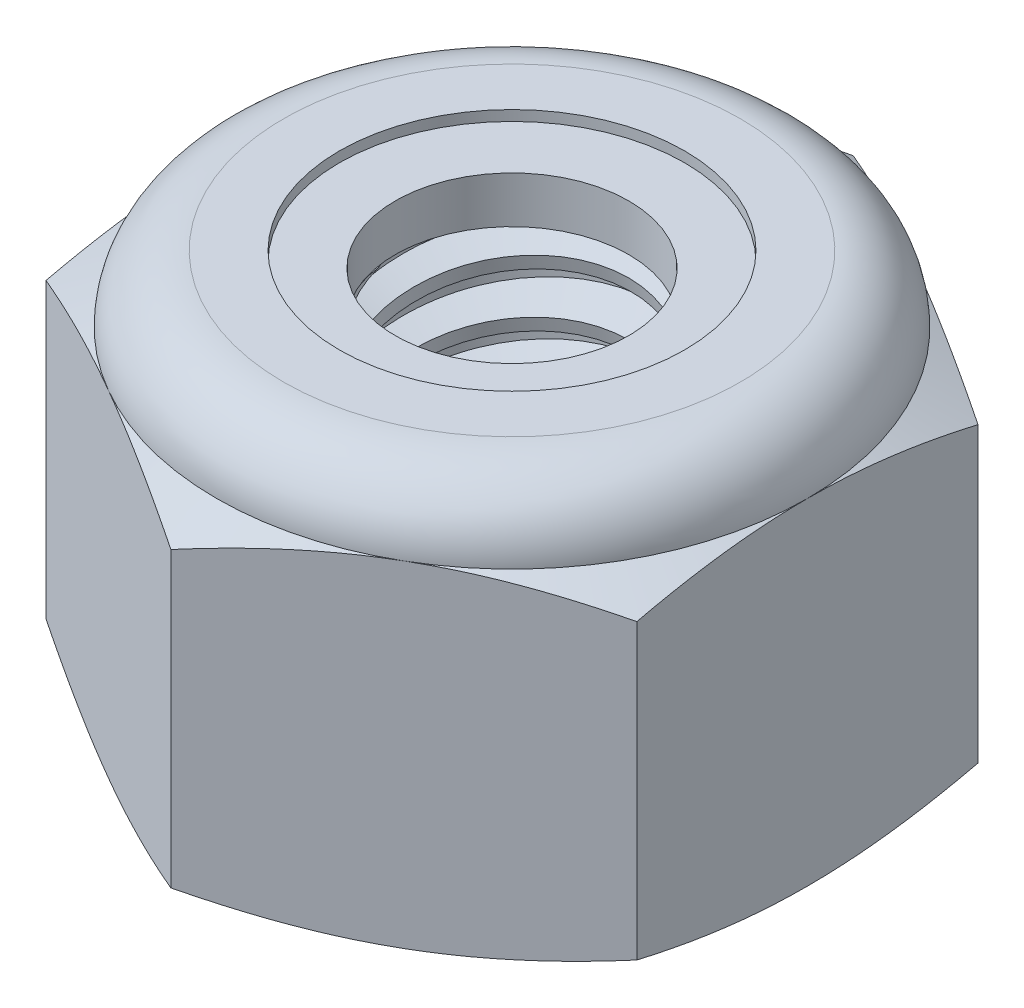
from build123d import *

# Parameters (mm, degrees)
EXTRUDE1_DEPTH       = 5.953125
SKETCH2_W            = 2.0828
SKETCH2_H            = 5.953125
LPATTERN1_COUNT      = 8
LPATTERN1_PITCH      = 0.79375
LPATTERN1_COUNT_DIR2 = 2
LPATTERN1_PITCH_DIR2 = 0.79375


with BuildPart() as part:
    # Sketch1 → Extrude1 (new body)
    with BuildSketch(Plane(origin=(0, 0, 0), x_dir=(1, 0, 0), z_dir=(0, 1, 0))):
        Polygon((0, 5.040989538), (-4.365625, 2.520494769), (-4.365625, -2.520494769), (0, -5.040989538), (4.365625, -2.520494769), (4.365625, 2.520494769), align=None)
    extrude(amount=EXTRUDE1_DEPTH)

    # Sketch4 → Cut-Revolve2 (revolve, cut)
    with BuildSketch(Plane(origin=(0, 0, 0), x_dir=(0, 0, -1), z_dir=(1, 0, 0))):
        Polygon((0, 5.953125), (2.0828, 5.953125), (1.725765218, 5.786636947), (1.725765218, 0.166488053), (2.0828, 0), (0, 0), align=None)
    revolve(axis=Axis((0, 5.953125, 0), (0, 1, 0)), mode=Mode.SUBTRACT)


with BuildPart() as body_2:
    # Sketch2 → Revolve1 (revolve)
    with BuildSketch(Plane(origin=(0, 0, 0), x_dir=(0, 0, -1), z_dir=(1, 0, 0))):
        with Locations((1.0414, 2.9765625)):
            Rectangle(SKETCH2_W, SKETCH2_H)
    revolve(axis=Axis((0, -2.0828, 0), (0, 1, 0)))

    # Sketch3 → Cut-Revolve1 (revolve, cut)
    with BuildSketch(Plane(origin=(0, 0, 0), x_dir=(0, 0, -1), z_dir=(1, 0, 0))):
        Polygon((2.101371857, 5.855659896), (2.231374854, 5.173404168), (1.762908932, 5.33664843), (1.725765218, 5.531578638), align=None)
    cut_revolve1 = revolve(axis=Axis((0, 5.953125, 0.162231854), (0, -0.9823254572523517, -0.18718091792156125)), mode=Mode.SUBTRACT)

    # LPattern1: Cut-Revolve1 8 × 2
    with Locations(*[Vector(0, -1, 0) * (i * LPATTERN1_PITCH) + Vector(0, 1, 0) * (j * LPATTERN1_PITCH_DIR2) for i in range(LPATTERN1_COUNT) for j in range(LPATTERN1_COUNT_DIR2) if (i, j) != (0, 0)]):
        add(cut_revolve1, mode=Mode.SUBTRACT)


with BuildPart() as part_1:
    add(part.part)

    # Combine1: cut body 2
    add(body_2.part, mode=Mode.SUBTRACT)

    # Sketch5 → Cut-Revolve3 (revolve, cut)
    with BuildSketch(Plane(origin=(0, 0, 0), x_dir=(0, 0, -1), z_dir=(1, 0, 0))):
        with BuildLine():
            Line((0, 0), (4.365625, 0))
            Line((4.365625, 0), (5.040989538, 0.314927656))
            Line((5.040989538, 0.314927656), (5.040989538, 4.646009844))
            Line((5.040989538, 4.646009844), (4.365625, 4.9609375))
            ThreePointArc((4.365625, 4.9609375), (4.075020009, 5.662520009), (3.3734375, 5.953125))
            Line((3.3734375, 5.953125), (3.3734375, 7.223125))
            Line((3.3734375, 7.223125), (6.310989538, 7.223125))
            Line((6.310989538, 7.223125), (6.310989538, -1.27))
            Line((6.310989538, -1.27), (0, -1.27))
            Line((0, -1.27), (0, 0))
        make_face()
    revolve(axis=Axis((0, 0, 0), (0, 1, 0)), mode=Mode.SUBTRACT)

    # Sketch6 → Cut-Revolve4 (revolve, cut)
    with BuildSketch(Plane(origin=(0, 0, 0), x_dir=(0, 0, -1), z_dir=(1, 0, 0))):
        with BuildLine():
            Line((0, 4.9609375), (4.213225, 4.9609375))
            ThreePointArc((4.213225, 4.9609375), (3.967256936, 5.554756936), (3.3734375, 5.800725))
            Line((3.3734375, 5.800725), (2.549601359, 5.800725))
            Line((2.549601359, 5.800725), (2.549601359, 7.223125))
            Line((2.549601359, 7.223125), (0, 7.223125))
            Line((0, 7.223125), (0, 4.9609375))
        make_face()
    revolve(axis=Axis((0, 7.223125, 0), (0, 1, 0)), mode=Mode.SUBTRACT)


with BuildPart() as body_2_2:
    # Sketch7 → Revolve2 (revolve)
    with BuildSketch(Plane(origin=(0, 0, 0), x_dir=(0, 0, -1), z_dir=(1, 0, 0))):
        with BuildLine():
            Line((1.725765218, 5.0371375), (4.133213408, 5.0371375))
            ThreePointArc((4.133213408, 5.0371375), (3.885726726, 5.527175629), (3.3734375, 5.724525))
            Line((3.3734375, 5.724525), (1.725765218, 5.724525))
            Line((1.725765218, 5.724525), (1.725765218, 5.0371375))
        make_face()
    revolve(axis=Axis((0, 5.0371375, 0), (0, 1, 0)))


solid = Compound([part_1.part, body_2_2.part])
